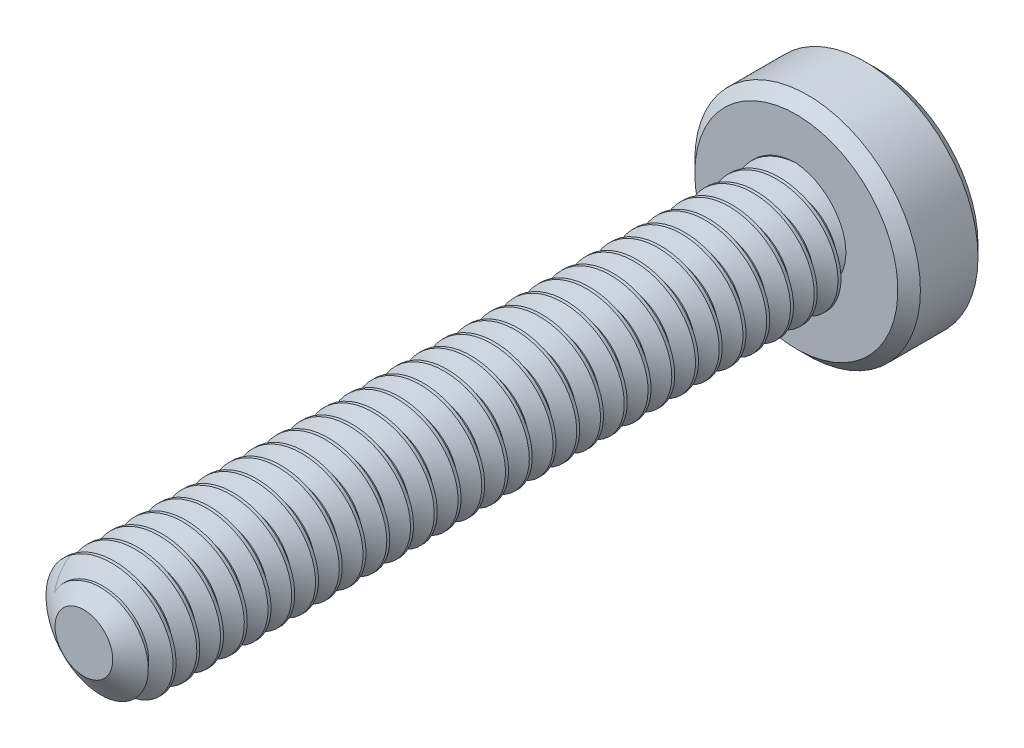
from build123d import *

# Parameters (mm, degrees)
SKETCH1_R          = 1
EXTRUDE1_DEPTH     = 12
CUT_SWEEP1_PITCH   = 0.4
SKETCH6_R          = 1.9
EXTRUDE2_DEPTH     = 1.35
CUT_EXTRUDE1_DEPTH = 0.975
CHAMFER1_SIZE      = 0.19


with BuildPart() as part:
    # Sketch1 → Extrude1 (new body)
    with BuildSketch(Plane.XY):
        Circle(SKETCH1_R)
    extrude(amount=-EXTRUDE1_DEPTH)

    # Cut-Sweep1: the profile of Sketch3 profile screwed along a right-hand helix of 31 turns, 6 arcs to a turn; built about Z, then put on its axis
    cut_sweep1_z = Axis((0, 0, 0), (0, 0, 1))
    cut_sweep1_corners = [(1.0003, 0, -0.350173205), (0.740192379, 0, -0.2), (0.740192379, 0, -0.15), (1.0003, 0, 0.000173205)]
    with BuildLine(mode=Mode.PRIVATE) as cut_sweep1_profile:
        Line(cut_sweep1_corners[0], cut_sweep1_corners[1])
        Line(cut_sweep1_corners[1], cut_sweep1_corners[2])
        Line(cut_sweep1_corners[2], cut_sweep1_corners[3])
        Line(cut_sweep1_corners[3], cut_sweep1_corners[0])
    cut_sweep1_cap = Face(cut_sweep1_profile.wire())
    cut_sweep1_turn_angles = [0, 30, 60, 90, 120, 150, 180, 210, 240, 270, 300, 330, 360]
    cut_sweep1_turn_weights = [1, 0.8660254037844387, 1, 0.8660254037844387, 1, 0.8660254037844387, 1, 0.8660254037844387, 1, 0.8660254037844387, 1, 0.8660254037844387, 1]
    cut_sweep1_turn_rails = [Edge.make_bspline([Vector(p[0], p[1], 0).rotate(cut_sweep1_z, cut_sweep1_turn_angles[k]) / cut_sweep1_turn_weights[k] + Vector(0, 0, p[2] + CUT_SWEEP1_PITCH * cut_sweep1_turn_angles[k] / 360) for k in range(13)], [0, 0, 0, 1, 1, 2, 2, 3, 3, 4, 4, 5, 5, 6, 6, 6], 2, cut_sweep1_turn_weights) for p in cut_sweep1_corners]
    cut_sweep1_turn_sides = [Face.make_surface_from_curves(cut_sweep1_turn_rails[p[0]], cut_sweep1_turn_rails[p[1]]) for p in [(0, 1), (1, 2), (2, 3), (3, 0)]]
    cut_sweep1 = Plane(origin=(0, 0, 0), x_dir=(0, 1, 0), z_dir=(0, 0, -1)) * Solid(Shell([*[p.moved(Location((0, 0, CUT_SWEEP1_PITCH * i))) for i in range(31) for p in cut_sweep1_turn_sides], cut_sweep1_cap, cut_sweep1_cap.rotate(cut_sweep1_z, 11160).moved(Location((0, 0, CUT_SWEEP1_PITCH * 11160 / 360)))]))
    add(cut_sweep1, mode=Mode.SUBTRACT)

    # Sketch4 → Cut-Revolve1 (revolve, cut)
    with BuildSketch(Plane(origin=(0, 0, 0), x_dir=(0, 0, -1), z_dir=(1, 0, 0)), mode=Mode.PRIVATE) as cut_revolve1_sk:
        Polygon((0.35977197, 1), (0, 0.486192379), (0, 1), align=None)
    revolve(cut_revolve1_sk.sketch.rotate(Axis((0, 0, 0), (0, 0, -1)), 278.428757719), axis=Axis((0, 0, 0), (0, 0, -1)), mode=Mode.SUBTRACT)

    # Sketch6 → Extrude2 (add)
    with BuildSketch(Plane(origin=(0, 0, -12), x_dir=(-1, 0, 0), z_dir=(0, 0, -1))):
        with Locations(Location((0, 0, 0), (0, 0, 180))):
            Circle(SKETCH6_R)
    extrude(amount=EXTRUDE2_DEPTH)

    # Sketch7 → Cut-Extrude1 (cut)
    with BuildSketch(Plane(origin=(0, 0, -13.35), x_dir=(-1, 0, 0), z_dir=(0, 0, -1))):
        Polygon((0, 0.75055535), (-0.65, 0.375277675), (-0.65, -0.375277675), (0, -0.75055535), (0.65, -0.375277675), (0.65, 0.375277675), align=None)
    extrude(amount=-CUT_EXTRUDE1_DEPTH, mode=Mode.SUBTRACT)

    # Cut-Extrude2 cone 1 section (through the dimple's axis) → Cut-Extrude2 (revolve, cut)
    with BuildSketch(Plane(origin=(0, 0, -13.35), x_dir=(0, 1, 0), z_dir=(1, 0, 0))):
        Polygon((0, 0), (0.75055535, 0), (0, 0.75055535), align=None)
    revolve(axis=Axis((0, 0, -13.35), (0, 0, 1)), mode=Mode.SUBTRACT)

    # Chamfer1
    chamfer1_edges = [part.edges().sort_by_distance(p)[0] for p in [
        (-1.9, 0, -12),
        (-1.9, 0, -13.35),
    ]]
    chamfer(chamfer1_edges, length=CHAMFER1_SIZE)


solid = part.part
